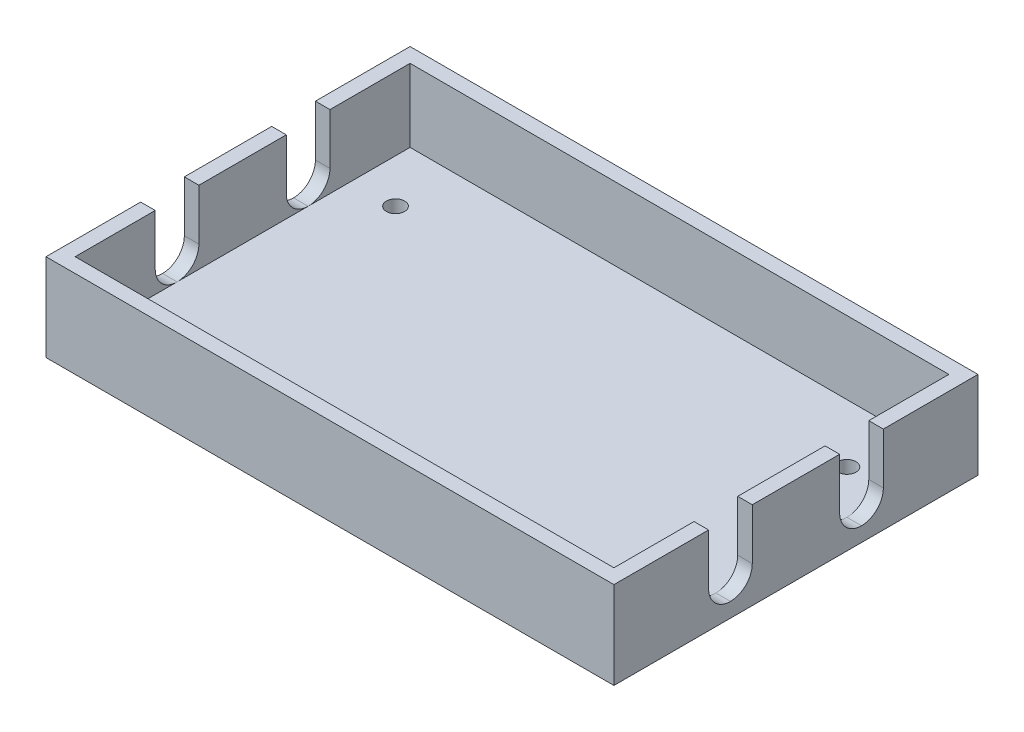
from build123d import *

# Parameters (mm, degrees)
BOSS_EXTRUDE1_DEPTH      = 10
SKETCH3_W                = 74
SKETCH3_H                = 46
BOSS_EXTRUDE2_DEPTH      = 2
SKETCH4_R                = 1.25
CUT_EXTRUDE1_DEPTH       = 10
BOSS_EXTRUDE3_DEPTH      = 10
BOSS_EXTRUDE3_DEPTH_BACK = 2
SKETCH5_W                = 78
SKETCH5_H                = 50
SKETCH5_W_2              = 74
SKETCH5_H_2              = 46
SKETCH9_W                = 86.285123911
SKETCH9_H                = 6
SKETCH9_W_2              = 83.939508892
CUT_EXTRUDE2_DEPTH       = 10
FILLET1_R                = 3


with BuildPart() as part:
    # Sketch2 → Boss-Extrude1 (new body)
    with BuildSketch(Plane.XY):
        Polygon((-18.5, 0.5), (-18.5, -1), (-14.5, -1), (-14.5, -3.5), (-21.5, -3.5), (-21.5, -1), (-21.5, 3), (20.5, 3), (20.5, -3.5), (13.5, -3.5), (13.5, -1), (17.5, -1), (17.5, 0.5), align=None)
    extrude(amount=BOSS_EXTRUDE1_DEPTH)

    # Sketch3 → Boss-Extrude2 (add)
    with BuildSketch(Plane(origin=(0, 3, 0), x_dir=(1, 0, 0), z_dir=(0, 1, 0))):
        with Locations((1, -5)):
            Rectangle(SKETCH3_W, SKETCH3_H)
    extrude(amount=BOSS_EXTRUDE2_DEPTH)

    # Sketch4 → Cut-Extrude1 (cut)
    with BuildSketch(Plane(origin=(0, 5, 0), x_dir=(1, 0, 0), z_dir=(0, 1, 0))):
        with Locations(Location((-30, 10, 0), (0, 0, 180))):
            Circle(SKETCH4_R)
        with Locations(Location((-30, -20, 0), (0, 0, 180))):
            Circle(SKETCH4_R)
        with Locations(Location((32, 10, 0), (0, 0, 180))):
            Circle(SKETCH4_R)
        with Locations(Location((32, -20, 0), (0, 0, 180))):
            Circle(SKETCH4_R)
    extrude(amount=-CUT_EXTRUDE1_DEPTH, mode=Mode.SUBTRACT)

    # Sketch5 → Boss-Extrude3 (add, two sides: drawn at the far end of the back side and taken through both)
    with BuildSketch(Plane(origin=(0, 5, 0), x_dir=(1, 0, 0), z_dir=(0, 1, 0)).offset(-BOSS_EXTRUDE3_DEPTH_BACK)):
        with Locations((1, -5)):
            Rectangle(SKETCH5_W, SKETCH5_H)
        with Locations((1, -5)):
            Rectangle(SKETCH5_W_2, SKETCH5_H_2, mode=Mode.SUBTRACT)
    extrude(amount=BOSS_EXTRUDE3_DEPTH + BOSS_EXTRUDE3_DEPTH_BACK)

    # Sketch9 → Cut-Extrude2 (cut)
    with BuildSketch(Plane(origin=(0, 15, 0), x_dir=(1, 0, 0), z_dir=(0, 1, 0))):
        with Locations((1.40422043, 4)):
            Rectangle(SKETCH9_W, SKETCH9_H)
        with Locations((0.90158864, -14)):
            Rectangle(SKETCH9_W_2, SKETCH9_H)
    extrude(amount=-CUT_EXTRUDE2_DEPTH, mode=Mode.SUBTRACT)

    # Fillet1
    fillet1_edges = [part.edges().sort_by_distance(p)[0] for p in [
        (-37, 5, 17),
        (-37, 5, 11),
        (-37, 5, -7),
        (-37, 5, -1),
        (39, 5, 17),
        (39, 5, 11),
        (39, 5, -7),
        (39, 5, -1),
    ]]
    fillet(fillet1_edges, radius=FILLET1_R - 0.0001)  # a hair under: the kernel refuses the full size


solid = part.part
